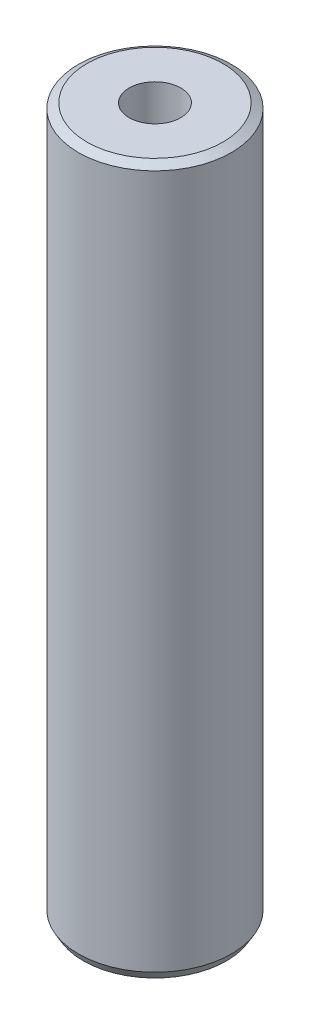
from build123d import *
from OCP.BRepFilletAPI import BRepFilletAPI_MakeChamfer

# Parameters (mm, degrees)
SKETCH1_R           = 30
BOSS_EXTRUDE1_DEPTH = 277.401554564
SKETCH2_R           = 10.123644851
CUT_EXTRUDE1_DEPTH  = 281.627194823
CHAMFER1_SIZE       = 1.914711706
CHAMFER1_SIZE2      = 3.316377957


with BuildPart() as part:
    # Sketch1 → Boss-Extrude1 (new body)
    with BuildSketch(Plane(origin=(0, 0, 0), x_dir=(1, 0, 0), z_dir=(0, 1, 0))):
        Circle(SKETCH1_R)
    extrude(amount=BOSS_EXTRUDE1_DEPTH)

    # Sketch2 → Cut-Extrude1 (cut, through all)
    with BuildSketch(Plane(origin=(0, 0, 0), x_dir=(1, 0, 0), z_dir=(0, 1, 0))):
        Circle(SKETCH2_R)
    extrude(amount=CUT_EXTRUDE1_DEPTH, mode=Mode.SUBTRACT)

    # Chamfer1: one chamfer whose edges measure the first distance from different faces: ONE call of the kernel's chamfer builder (chamfer() names one face for all edges)
    chamfer1_edges_1 = [part.edges().sort_by_distance(p)[0] for p in [
        (-30, 277.401554564, 0),
    ]]
    chamfer1_side_1 = [part.faces().sort_by_distance(p)[0] for p in [
        (-30, 138.700777282, 0),
    ]]
    chamfer1_edges_2 = [part.edges().sort_by_distance(p)[0] for p in [
        (-30, 0, 0),
    ]]
    chamfer1_side_2 = [part.faces().sort_by_distance(p)[0] for p in [
        (-29.151471863, 0, 0),
    ]]
    chamfer1 = BRepFilletAPI_MakeChamfer(part.part.solid().wrapped)
    for e in chamfer1_edges_1:
        chamfer1.Add(CHAMFER1_SIZE, CHAMFER1_SIZE2, e.wrapped, chamfer1_side_1[0].wrapped)  # the first distance lies on this face
    for e in chamfer1_edges_2:
        chamfer1.Add(CHAMFER1_SIZE, CHAMFER1_SIZE2, e.wrapped, chamfer1_side_2[0].wrapped)  # the first distance lies on this face
    add(Compound.cast(chamfer1.Shape()), mode=Mode.REPLACE)


solid = part.part
